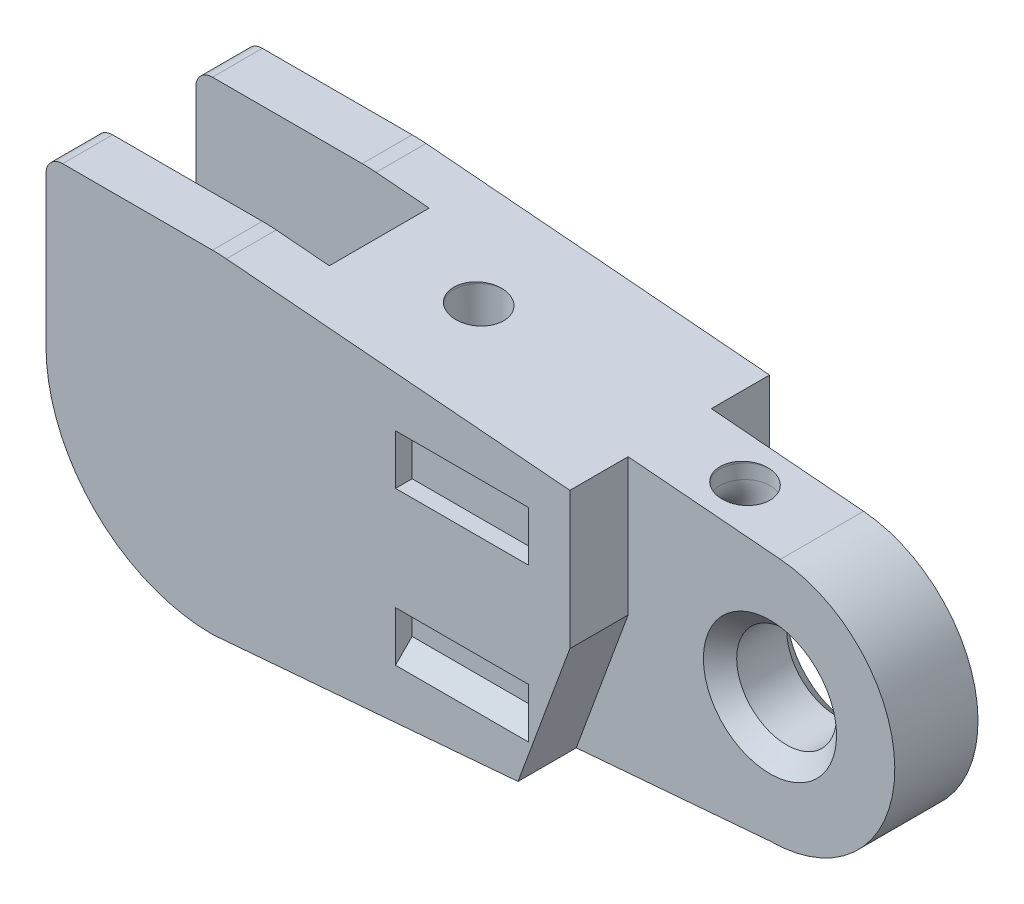
from build123d import *

# Parameters (mm, degrees)
BOSS_EXTRUDE1_DEPTH  = 6
SKETCH1_3_R          = 2.5
BOSS_EXTRUDE2_DEPTH  = 6
SKETCH1_5_R          = 3
BOSS_EXTRUDE3_DEPTH  = 4.5
SKETCH1_6_R          = 2.5
CUT_EXTRUDE2_DEPTH   = 3
CUT_EXTRUDE3_DEPTH   = 3
CUT_EXTRUDE4_START   = -10
CUT_EXTRUDE4_DEPTH   = 7.5
CUT_SWEEP5_PROFILE_R = 1.5
SKETCH1_7_R          = 2.5
BOSS_EXTRUDE4_DEPTH  = 6
CHAMFER1_SIZE        = 1
CUT_EXTRUDE5_DEPTH   = 4
MIRROR4_COPY_1_DEPTH = 4
MIRROR4_COPY_2_DEPTH = 4


with BuildPart() as part:
    # Sketch1 → Boss-Extrude1 (new, symmetric)
    with BuildSketch(Plane.XY):
        with BuildLine():
            Line((15.625, 7.473912964), (-14.166666667, 9.965217286))
            ThreePointArc((-14.166666667, 9.965217286), (-5.008579418, 0.414143408), (-13.344827586, -9.862068966))
            Line((-13.344827586, -9.862068966), (15, -7.5))
            ThreePointArc((15, -7.5), (7.506524597, 0.312772095), (15.625, 7.473912964))
        make_face()
    extrude(amount=BOSS_EXTRUDE1_DEPTH, both=True)

    # Sketch1<3> → Boss-Extrude2 (add, symmetric)
    with BuildSketch(Plane.XY):
        with BuildLine():
            ThreePointArc((-13.344827586, -9.862068966), (-5.008579418, 0.414143408), (-14.166666667, 9.965217286))
            ThreePointArc((-14.166666667, 9.965217286), (-14.58297054, 9.991300537), (-15, 10))
            Line((-15, 10), (-24, 10))
            ThreePointArc((-24, 10), (-24.707106781, 9.707106781), (-25, 9))
            Line((-25, 9), (-25, 0))
            ThreePointArc((-25, 0), (-22.071067812, -7.071067812), (-15, -10))
            Line((-15, -10), (-13.344827586, -9.862068966))
        make_face()
        with Locations((-15, 0)):
            Circle(SKETCH1_3_R, mode=Mode.SUBTRACT)
    extrude(amount=BOSS_EXTRUDE2_DEPTH, both=True)

    # Sketch1<5> → Boss-Extrude3 (add, symmetric)
    with BuildSketch(Plane.XY):
        with BuildLine():
            ThreePointArc((22.5, 0), (20.519850541, 5.077524003), (15.625, 7.473912964))
            ThreePointArc((15.625, 7.473912964), (7.506524597, 0.312772095), (15, -7.5))
            ThreePointArc((15, -7.5), (20.303300859, -5.303300859), (22.5, 0))
        make_face()
        with Locations((15, 0)):
            Circle(SKETCH1_5_R, mode=Mode.SUBTRACT)
    extrude(amount=BOSS_EXTRUDE3_DEPTH, both=True)

    # Sketch1<6> → Cut-Extrude2 (cut, symmetric)
    with BuildSketch(Plane.XY):
        with BuildLine():
            ThreePointArc((-13.344827586, -9.862068966), (-5.008579418, 0.414143408), (-14.166666667, 9.965217286))
            ThreePointArc((-14.166666667, 9.965217286), (-14.58297054, 9.991300537), (-15, 10))
            Line((-15, 10), (-24, 10))
            ThreePointArc((-24, 10), (-24.707106781, 9.707106781), (-25, 9))
            Line((-25, 9), (-25, 0))
            ThreePointArc((-25, 0), (-22.071067812, -7.071067812), (-15, -10))
            Line((-15, -10), (-13.344827586, -9.862068966))
        make_face()
        with Locations((-15, 0)):
            Circle(SKETCH1_6_R, mode=Mode.SUBTRACT)
    extrude(amount=CUT_EXTRUDE2_DEPTH, both=True, mode=Mode.SUBTRACT)

    # Sketch2 → Cut-Extrude3 (cut, symmetric)
    with BuildSketch(Plane.XY):
        with BuildLine():
            Line((-4.5, -10.5), (-4.5, 0))
            ThreePointArc((-4.5, 0), (-22.424621202, 7.424621202), (-15, -10.5))
            Line((-15, -10.5), (-4.5, -10.5))
        make_face()
    extrude(amount=CUT_EXTRUDE3_DEPTH, both=True, mode=Mode.SUBTRACT)

    # Sketch2<3> → Cut-Extrude4 (cut)
    with BuildSketch(Plane.XY.offset(CUT_EXTRUDE4_START)):
        with BuildLine():
            Line((6.475875471, 8.877657642), (6.475875471, 0))
            Line((6.475875471, 0), (3, -9.448823218))
            Line((3, -9.448823218), (15, -9.448823218))
            Line((15, -9.448823218), (15, -8))
            ThreePointArc((15, -8), (23, 0), (15, 8))
            Line((15, 8), (6.475875471, 8.877657642))
        make_face()
    cut_extrude4 = extrude(amount=CUT_EXTRUDE4_DEPTH, mode=Mode.SUBTRACT)

    # Mirror1: Cut-Extrude4 across plane
    add(cut_extrude4.mirror(Plane.XY), mode=Mode.SUBTRACT)

    # Cut-Sweep5: sweep along a path in Sketch3
    with BuildLine(Plane.XY) as cut_sweep5_path:
        Line((-5, 11.376707414), (-5, 9.19866211))
        Line((-5, 9.19866211), (-5, 7))
        ThreePointArc((-5, 7), (-4.121320344, 4.878679656), (-2, 4))
        Line((-2, 4), (8, 4))
        ThreePointArc((8, 4), (10.121320344, 4.878679656), (11, 7))
        Line((11, 7), (11, 7.860674894))
        Line((11, 7.860674894), (11, 10.978155515))
    # Cut-Sweep5 profile (on start of the path) → Cut-Sweep5 (sweep, cut)
    with BuildSketch(Plane(origin=(-5, 11.376707414, 0), x_dir=(0, 0, -1), z_dir=(0, -1, 0))):
        Circle(CUT_SWEEP5_PROFILE_R)
    cut_sweep5 = sweep(path=cut_sweep5_path.line, mode=Mode.SUBTRACT)

    # Mirror2: Cut-Sweep5 across plane
    add(cut_sweep5.mirror(Plane.ZX), mode=Mode.SUBTRACT)

    # Sketch1<7> → Boss-Extrude4 (add, symmetric)
    with BuildSketch(Plane.XY):
        with Locations((-15, 0)):
            Circle(SKETCH1_7_R)
    extrude(amount=BOSS_EXTRUDE4_DEPTH, both=True)

    # Chamfer1
    chamfer1_edges = [part.edges().sort_by_distance(p)[0] for p in [
        (12, 0, -2.5),
        (12, 0, 2.5),
        (-17.5, 0, 3),
        (-17.5, 0, -3),
    ]]
    chamfer(chamfer1_edges, length=CHAMFER1_SIZE)

    # Sketch139 → Cut-Extrude5 (cut, symmetric)
    with BuildSketch(Plane(origin=(0, 0, 0), x_dir=(0, 0, -1), z_dir=(1, 0, 0))):
        Polygon((6, 9.102109239), (6, 6.102109239), (5, 5.102109239), (5, 3.102109239), (7.604988318, 3.102109239), (7.604988318, 9.102109239), align=None)
    cut_extrude5 = extrude(amount=CUT_EXTRUDE5_DEPTH, both=True, mode=Mode.SUBTRACT)

    # Mirror3: Cut-Extrude5 across plane
    add(cut_extrude5.mirror(Plane.ZX), mode=Mode.SUBTRACT)

    # Mirror4 copy 1 sketch → Mirror4 copy 1 (cut, symmetric)
    with BuildSketch(Plane(origin=(0, 0, 0), x_dir=(0, 0, 1), z_dir=(1, 0, 0))):
        Polygon((6, 9.102109239), (6, 6.102109239), (5, 5.102109239), (5, 3.102109239), (7.604988318, 3.102109239), (7.604988318, 9.102109239), align=None)
    extrude(amount=MIRROR4_COPY_1_DEPTH, both=True, mode=Mode.SUBTRACT)

    # Mirror4 copy 2 sketch → Mirror4 copy 2 (cut, symmetric)
    with BuildSketch(Plane(origin=(0, 0, 0), x_dir=(0, 0, 1), z_dir=(1, 0, 0))):
        Polygon((6, -9.102109239), (6, -6.102109239), (5, -5.102109239), (5, -3.102109239), (7.604988318, -3.102109239), (7.604988318, -9.102109239), align=None)
    extrude(amount=MIRROR4_COPY_2_DEPTH, both=True, mode=Mode.SUBTRACT)


solid = part.part
